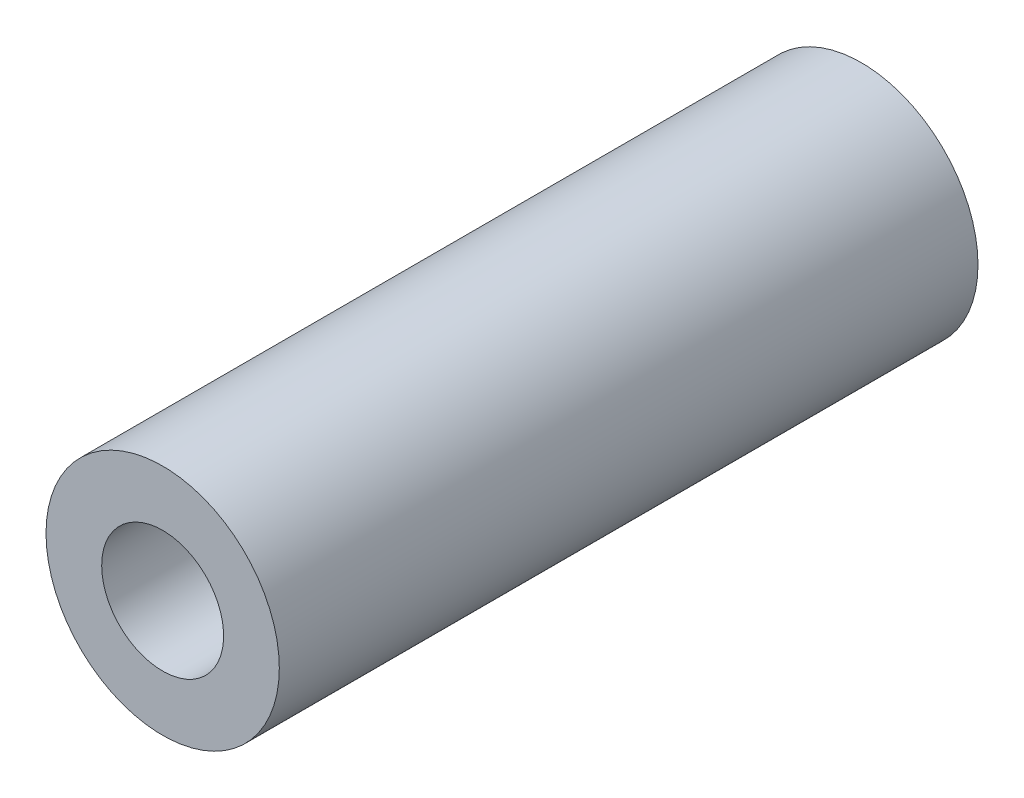
from build123d import *

# Parameters (mm, degrees)
SKETCH1_R           = 4.7625
SKETCH1_R_2         = 2.4892
BOSS_EXTRUDE1_DEPTH = 14.2621


with BuildPart() as part:
    # Sketch1 → Boss-Extrude1 (new, symmetric)
    with BuildSketch(Plane.XY):
        Circle(SKETCH1_R)
        Circle(SKETCH1_R_2, mode=Mode.SUBTRACT)
    extrude(amount=BOSS_EXTRUDE1_DEPTH, both=True)


solid = part.part
